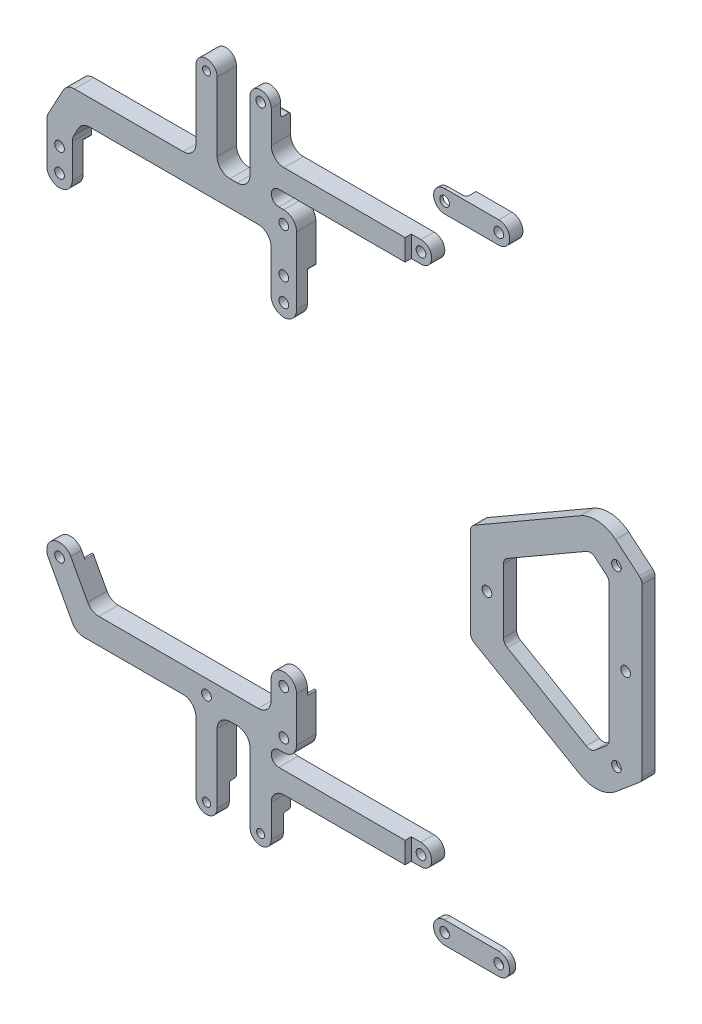
from build123d import *

# Parameters (mm, degrees)
BOSS_EXTRUDE1_OUTLINE_R     = 1.375
BOSS_EXTRUDE1_OUTLINE_R_2   = 1.03775
BOSS_EXTRUDE1_OUTLINE_R_3   = 1.25
BOSS_EXTRUDE1_DEPTH         = 5
BOSS_EXTRUDE1_2_OUTLINE_R   = 1.03775
BOSS_EXTRUDE1_2_OUTLINE_R_2 = 1.25
BOSS_EXTRUDE1_2_OUTLINE_R_3 = 1.375
BOSS_EXTRUDE1_2_DEPTH       = 5
CUT_EXTRUDE4_DEPTH          = 303.619216671
CUT_EXTRUDE4_DEPTH_BACK     = 303.619216671
SKETCH1_3_R                 = 1.22275
SKETCH1_3_R_2               = 1.25
FILLET1_R                   = 3.3
FILLET2_R                   = 3.3
FILLET13_R                  = 1.975016
FILLET14_R                  = 1.975016
SKETCH7_R                   = 1.25
CUT_EXTRUDE8_DEPTH          = 303.619216671
SKETCH2_R                   = 1.03775
CUT_EXTRUDE1_DEPTH          = 2.55
SKETCH3_R                   = 3.3
CUT_EXTRUDE2_DEPTH          = 2.2
FILLET3_START               = -1
FILLET3_DEPTH               = 3.2
FILLET4_START               = -1
FILLET4_DEPTH               = 3.2
MOVE_FACE6_BY               = 0.7
MOVE_FACE6_2_BY             = 0.7
FILLET5_R                   = 0.5
FILLET6_R                   = 0.5
MOVE_FACE3_BY               = 0.125
MOVE_FACE3_2_BY             = 0.125
MOVE_FACE3_3_BY             = 0.125
MOVE_FACE3_4_BY             = 0.125
MOVE_FACE4_BY               = 0.125
MOVE_FACE4_2_BY             = 0.125
SKETCH6_R                   = 2.475
CUT_EXTRUDE5_DEPTH          = 2.2
SKETCH9_R                   = 1.25
BOSS_EXTRUDE2_DEPTH         = 3.4
MOVE_FACE5_DEPTH            = 3.4
FILLET9_R                   = 2
SKETCH10_R                  = 2.475
CUT_EXTRUDE6_DEPTH          = 2.2
FILLET10_R                  = 0.5
FILLET11_R                  = 8
BOSS_EXTRUDE3_START         = -3.15
SKETCH11_R                  = 1.25
BOSS_EXTRUDE3_DEPTH         = 1.55
BOSS_EXTRUDE4_START         = -5
SKETCH12_R                  = 1.25
BOSS_EXTRUDE4_DEPTH         = 3.4
CUT_EXTRUDE7_START          = -3.4
CUT_EXTRUDE7_DEPTH          = 2.55
FILLET12_R                  = 0.75
CUT_EXTRUDE9_START          = -1.6
CUT_EXTRUDE9_DEPTH          = 1.6


with BuildPart() as part:
    # Boss-Extrude1: read off the stored shape, not the designer's step
    # Boss-Extrude1 outline → Boss-Extrude1 (new body)
    with BuildSketch(Plane.XY):
        with BuildLine():
            Line((-122.796119502, -112.908535498), (-122.796119502, -95.408535498))
            ThreePointArc((-122.796119502, -95.408535498), (-123.762667124, -93.075083121), (-126.096119502, -92.108535498))
            Line((-126.096119502, -92.108535498), (-129.338533212, -92.108535498))
            Line((-129.338533212, -92.108535498), (-129.338533212, -88.158504334))
            Line((-129.338533212, -88.158504334), (-92.206195383, -88.158504334))
            ThreePointArc((-92.206195383, -88.158504334), (-89.456195383, -85.408504334), (-92.206195383, -82.658504334))
            Line((-92.206195383, -82.658504334), (-129.338533212, -82.658504334))
            Line((-129.338533212, -82.658504334), (-129.338533212, -71.004269418))
            ThreePointArc((-129.338533212, -71.004269418), (-132.088533212, -68.254269418), (-134.838533212, -71.004269418))
            Line((-134.838533212, -71.004269418), (-134.838533212, -92.108535498))
            Line((-134.838533212, -92.108535498), (-143.338533212, -92.108535498))
            Line((-143.338533212, -92.108535498), (-143.338533212, -71.004269418))
            ThreePointArc((-143.338533212, -71.004269418), (-146.088533212, -68.254269418), (-148.838533212, -71.004269418))
            Line((-148.838533212, -71.004269418), (-148.838533212, -92.108535498))
            Line((-148.838533212, -92.108535498), (-180.236574103, -92.108535498))
            ThreePointArc((-180.236574103, -92.108535498), (-181.923841287, -92.57249434), (-183.136670575, -93.83391159))
            Line((-183.136670575, -93.83391159), (-186.996215974, -100.942309939))
            ThreePointArc((-186.996215974, -100.942309939), (-187.294581504, -101.704627981), (-187.396119502, -102.516933848))
            Line((-187.396119502, -102.516933848), (-187.396119502, -112.908535498))
            ThreePointArc((-187.396119502, -112.908535498), (-184.096119502, -116.208535498), (-180.796119502, -112.908535498))
            Line((-180.796119502, -112.908535498), (-180.796119502, -103.355027081))
            Line((-180.796119502, -103.355027081), (-178.273280414, -98.708535498))
            Line((-178.273280414, -98.708535498), (-129.396119502, -98.708535498))
            Line((-129.396119502, -98.708535498), (-129.396119502, -112.908535498))
            ThreePointArc((-129.396119502, -112.908535498), (-126.096119502, -116.208535498), (-122.796119502, -112.908535498))
        make_face()
        with Locations((-184.096119502, -112.908535498)):
            Circle(BOSS_EXTRUDE1_OUTLINE_R, mode=Mode.SUBTRACT)
        with Locations((-184.096119502, -106.908535498)):
            Circle(BOSS_EXTRUDE1_OUTLINE_R, mode=Mode.SUBTRACT)
        with Locations((-126.096119502, -112.908535498)):
            Circle(BOSS_EXTRUDE1_OUTLINE_R, mode=Mode.SUBTRACT)
        with Locations((-126.096119502, -106.908535498)):
            Circle(BOSS_EXTRUDE1_OUTLINE_R, mode=Mode.SUBTRACT)
        with Locations((-146.088533212, -71.004269418)):
            Circle(BOSS_EXTRUDE1_OUTLINE_R_2, mode=Mode.SUBTRACT)
        with Locations((-92.206195383, -85.408504334)):
            Circle(BOSS_EXTRUDE1_OUTLINE_R_3, mode=Mode.SUBTRACT)
    extrude(amount=BOSS_EXTRUDE1_DEPTH)

    # Sketch1<3> → Cut-Extrude4 (cut, two sides: drawn at the far end of the back side and taken through both)
    with BuildSketch(Plane.XY.offset(-CUT_EXTRUDE4_DEPTH_BACK)):
        with Locations((-132.088533212, -71.004269418)):
            Circle(SKETCH1_3_R)
        with Locations((-92.206195383, -95.408504334)):
            Circle(SKETCH1_3_R_2)
        with Locations((-126.096119502, -95.408504334)):
            Circle(SKETCH1_3_R_2)
    extrude(amount=CUT_EXTRUDE4_DEPTH + CUT_EXTRUDE4_DEPTH_BACK, mode=Mode.SUBTRACT)

    # Fillet1
    fillet1_edges = [part.edges().sort_by_distance(p)[0] for p in [
        (-129.338533212, -82.658504334, 2.5),
        (-148.838533212, -92.108535498, 2.5),
        (-143.338533212, -92.108535498, 2.5),
        (-129.396119502, -98.708535498, 2.5),
        (-178.273280414, -98.708535498, 2.5),
        (-180.796119502, -103.355027081, 2.5),
        (-134.838533212, -92.108535498, 2.5),
    ]]
    fillet(fillet1_edges, radius=FILLET1_R)

    # Fillet13
    fillet13_edges = [part.edges().sort_by_distance(p)[0] for p in [
        (-129.338533212, -88.158504334, 2.5),
        (-129.338533212, -92.108535498, 2.5),
    ]]
    fillet(fillet13_edges, radius=FILLET13_R - 0.0001)  # a hair under: the kernel refuses the full size


with BuildPart() as body_2:
    # Boss-Extrude1 2 outline → Boss-Extrude1 2 (new body)
    with BuildSketch(Plane.XY):
        with BuildLine():
            Line((-129.338533212, -217.658566663), (-129.338533212, -213.708535498))
            Line((-129.338533212, -213.708535498), (-126.096119502, -213.708535498))
            ThreePointArc((-126.096119502, -213.708535498), (-123.762667124, -212.741987876), (-122.796119502, -210.408535498))
            Line((-122.796119502, -210.408535498), (-122.796119502, -198.908535498))
            ThreePointArc((-122.796119502, -198.908535498), (-126.096119502, -195.608535498), (-129.396119502, -198.908535498))
            Line((-129.396119502, -198.908535498), (-129.396119502, -207.108535498))
            Line((-129.396119502, -207.108535498), (-175.888835267, -207.108535498))
            Line((-175.888835267, -207.108535498), (-181.19602303, -197.33391159))
            ThreePointArc((-181.19602303, -197.33391159), (-185.67074341, -196.008439027), (-186.996215974, -200.483159407))
            Line((-186.996215974, -200.483159407), (-180.752225428, -211.983159407))
            ThreePointArc((-180.752225428, -211.983159407), (-179.53939614, -213.244576656), (-177.852128956, -213.708535498))
            Line((-177.852128956, -213.708535498), (-148.838533212, -213.708535498))
            Line((-148.838533212, -213.708535498), (-148.838533212, -234.812801579))
            ThreePointArc((-148.838533212, -234.812801579), (-146.088533212, -237.562801579), (-143.338533212, -234.812801579))
            Line((-143.338533212, -234.812801579), (-143.338533212, -213.708535498))
            Line((-143.338533212, -213.708535498), (-134.838533212, -213.708535498))
            Line((-134.838533212, -213.708535498), (-134.838533212, -234.812801579))
            ThreePointArc((-134.838533212, -234.812801579), (-132.088533212, -237.562801579), (-129.338533212, -234.812801579))
            Line((-129.338533212, -234.812801579), (-129.338533212, -223.158566663))
            Line((-129.338533212, -223.158566663), (-92.206195383, -223.158566663))
            ThreePointArc((-92.206195383, -223.158566663), (-89.456195383, -220.408566663), (-92.206195383, -217.658566663))
            Line((-92.206195383, -217.658566663), (-129.338533212, -217.658566663))
        make_face()
        with Locations((-146.088533212, -234.812801579)):
            Circle(BOSS_EXTRUDE1_2_OUTLINE_R, mode=Mode.SUBTRACT)
        with Locations((-132.088533212, -234.812801579)):
            Circle(BOSS_EXTRUDE1_2_OUTLINE_R, mode=Mode.SUBTRACT)
        with Locations((-92.206195383, -220.408566663)):
            Circle(BOSS_EXTRUDE1_2_OUTLINE_R_2, mode=Mode.SUBTRACT)
        with Locations((-184.096119502, -198.908535498)):
            Circle(BOSS_EXTRUDE1_2_OUTLINE_R_3, mode=Mode.SUBTRACT)
        with Locations((-126.096119502, -210.408535498)):
            Circle(BOSS_EXTRUDE1_2_OUTLINE_R_2, mode=Mode.SUBTRACT)
        with Locations((-126.096119502, -198.908535498)):
            Circle(BOSS_EXTRUDE1_2_OUTLINE_R_3, mode=Mode.SUBTRACT)
    extrude(amount=BOSS_EXTRUDE1_2_DEPTH)

    # Fillet2
    fillet2_edges = [body_2.edges().sort_by_distance(p)[0] for p in [
        (-129.396119502, -207.108535498, 2.5),
        (-175.888835267, -207.108535498, 2.5),
        (-148.838533212, -213.708535498, 2.5),
        (-143.338533212, -213.708535498, 2.5),
        (-134.838533212, -213.708535498, 2.5),
        (-129.338533212, -223.158566663, 2.5),
    ]]
    fillet(fillet2_edges, radius=FILLET2_R)

    # Fillet14
    fillet14_edges = [body_2.edges().sort_by_distance(p)[0] for p in [
        (-129.338533212, -217.658566663, 2.5),
        (-129.338533212, -213.708535498, 2.5),
    ]]
    fillet(fillet14_edges, radius=FILLET14_R - 0.0001)  # a hair under: the kernel refuses the full size

    # Sketch7 → Cut-Extrude8 (cut, through all)
    with BuildSketch(Plane.XY.offset(5)):
        with Locations((-146.088533212, -210.812801579)):
            Circle(SKETCH7_R)
    extrude(amount=-CUT_EXTRUDE8_DEPTH, mode=Mode.SUBTRACT)


with BuildPart() as cut_extrude1_tool:
    # Sketch2 → Cut-Extrude1 (new body)
    # profile 1 of 3: a face of its own
    with BuildSketch(Plane(origin=(0, 0, 0), x_dir=(-1, 0, 0), z_dir=(0, 0, -1))):
        with BuildLine():
            Line((134.838533212, -74.304269418), (134.838533212, -71.004269418))
            ThreePointArc((134.838533212, -71.004269418), (132.088533212, -68.254269418), (129.338533212, -71.004269418))
            Line((129.338533212, -71.004269418), (129.338533212, -74.304269418))
            Line((129.338533212, -74.304269418), (134.838533212, -74.304269418))
        make_face()
        with Locations((132.088533212, -71.004269418)):
            Circle(SKETCH2_R, mode=Mode.SUBTRACT)
    # profile 2 of 3: a face of its own
    with BuildSketch(Plane(origin=(0, 0, 0), x_dir=(-1, 0, 0), z_dir=(0, 0, -1))):
        with BuildLine():
            Line((143.338533212, -230.312801579), (143.338533212, -234.812801579))
            ThreePointArc((143.338533212, -234.812801579), (146.088533212, -237.562801579), (148.838533212, -234.812801579))
            Line((148.838533212, -234.812801579), (148.838533212, -230.312801579))
            Line((148.838533212, -230.312801579), (143.338533212, -230.312801579))
        make_face()
        with Locations((146.088533212, -234.812801579)):
            Circle(SKETCH2_R, mode=Mode.SUBTRACT)
    # profile 3 of 3: a face of its own
    with BuildSketch(Plane(origin=(0, 0, 0), x_dir=(-1, 0, 0), z_dir=(0, 0, -1))):
        with BuildLine():
            Line((129.338533212, -230.312801579), (129.338533212, -234.812801579))
            ThreePointArc((129.338533212, -234.812801579), (132.088533212, -237.562801579), (134.838533212, -234.812801579))
            Line((134.838533212, -234.812801579), (134.838533212, -230.312801579))
            Line((134.838533212, -230.312801579), (129.338533212, -230.312801579))
        make_face()
        with Locations((132.088533212, -234.812801579)):
            Circle(SKETCH2_R, mode=Mode.SUBTRACT)
    extrude(amount=-CUT_EXTRUDE1_DEPTH)


with BuildPart() as part_1:
    add(part.part)

    # Cut-Extrude1: cut by cut_extrude1_tool
    add(cut_extrude1_tool.part, mode=Mode.SUBTRACT)


with BuildPart() as body_2_1:
    add(body_2.part)

    # Cut-Extrude1: cut by cut_extrude1_tool
    add(cut_extrude1_tool.part, mode=Mode.SUBTRACT)


with BuildPart() as cut_extrude2_tool:
    # Sketch3 → Cut-Extrude2 (new body)
    with BuildSketch(Plane(origin=(0, 0, 0), x_dir=(-1, 0, 0), z_dir=(0, 0, -1))):
        with Locations((126.096119502, -198.908535498)):
            Circle(SKETCH3_R)
        with Locations((184.096119502, -198.908535498)):
            Circle(SKETCH3_R)
        with BuildLine():
            Line((122.796119502, -112.908535498), (122.796119502, -106.908535498))
            ThreePointArc((122.796119502, -106.908535498), (126.096119502, -103.608535498), (129.396119502, -106.908535498))
            Line((129.396119502, -106.908535498), (129.396119502, -112.908535498))
            ThreePointArc((129.396119502, -112.908535498), (126.096119502, -116.208535498), (122.796119502, -112.908535498))
        make_face()
        with BuildLine():
            Line((180.796119502, -112.908535498), (180.796119502, -106.908535498))
            ThreePointArc((180.796119502, -106.908535498), (184.096119502, -103.608535498), (187.396119502, -106.908535498))
            Line((187.396119502, -106.908535498), (187.396119502, -112.908535498))
            ThreePointArc((187.396119502, -112.908535498), (184.096119502, -116.208535498), (180.796119502, -112.908535498))
        make_face()
    extrude(amount=-CUT_EXTRUDE2_DEPTH)


with BuildPart() as part_2:
    add(part_1.part)

    # Cut-Extrude2: cut by cut_extrude2_tool
    add(cut_extrude2_tool.part, mode=Mode.SUBTRACT)

    # Fillet3: read off the stored shape, not the designer's step
    # Fillet3 outline → Fillet3 (cut)
    with BuildSketch(Plane.XY.offset(FILLET3_START)):
        with BuildLine():
            Line((-180.796119502, -106.908535498), (-180.796119502, -105.091945286))
            ThreePointArc((-180.796119502, -105.091945286), (-180.979776391, -105.33298178), (-181.260908235, -105.219874174))
            ThreePointArc((-181.260908235, -105.219874174), (-180.914437778, -106.032806425), (-180.796119502, -106.908535498))
        make_face()
        with BuildLine():
            ThreePointArc((-187.396119502, -106.908535498), (-187.277801226, -106.032806426), (-186.93133077, -105.219874174))
            ThreePointArc((-186.93133077, -105.219874174), (-187.212462614, -105.33298178), (-187.396119502, -105.091945286))
            Line((-187.396119502, -105.091945286), (-187.396119502, -106.908535498))
        make_face()
        with BuildLine():
            Line((-122.796119502, -106.908535498), (-122.796119502, -105.091945286))
            ThreePointArc((-122.796119502, -105.091945286), (-122.979776391, -105.33298178), (-123.260908235, -105.219874174))
            ThreePointArc((-123.260908235, -105.219874174), (-122.914437778, -106.032806425), (-122.796119502, -106.908535498))
        make_face()
        with BuildLine():
            ThreePointArc((-129.396119502, -106.908535498), (-129.277801226, -106.032806426), (-128.93133077, -105.219874174))
            ThreePointArc((-128.93133077, -105.219874174), (-129.212462614, -105.33298178), (-129.396119502, -105.091945286))
            Line((-129.396119502, -105.091945286), (-129.396119502, -106.908535498))
        make_face()
    extrude(amount=FILLET3_DEPTH, mode=Mode.SUBTRACT)

    # Fillet6
    fillet6_edges = [part_2.edges().sort_by_distance(p)[0] for p in [
        (-132.088533212, -74.304269418, 2.55),
        (-132.088533212, -74.304269418, 0),
    ]]
    fillet(fillet6_edges, radius=FILLET6_R)

    # Move Face3: a curved face moved outward by 0.125
    add(Solid.thicken(part_2.faces().sort_by_distance((-127.471119502, -112.908535498, 3.6))[0], MOVE_FACE3_BY))

    # Move Face3 2: a curved face moved outward by 0.125
    add(Solid.thicken(part_2.faces().sort_by_distance((-185.471119502, -112.908535498, 3.6))[0], MOVE_FACE3_2_BY))

    # Move Face3 3: a curved face moved outward by 0.125
    add(Solid.thicken(part_2.faces().sort_by_distance((-185.471119502, -106.908535498, 3.6))[0], MOVE_FACE3_3_BY))

    # Move Face3 4: a curved face moved outward by 0.125
    add(Solid.thicken(part_2.faces().sort_by_distance((-127.471119502, -106.908535498, 3.6))[0], MOVE_FACE3_4_BY))


with BuildPart() as body_2_2:
    add(body_2_1.part)

    # Cut-Extrude2: cut by cut_extrude2_tool
    add(cut_extrude2_tool.part, mode=Mode.SUBTRACT)

    # Fillet4: read off the stored shape, not the designer's step
    # Fillet4 outline → Fillet4 (cut)
    with BuildSketch(Plane.XY.offset(FILLET4_START)):
        with BuildLine():
            ThreePointArc((-181.19602303, -197.33391159), (-180.882141358, -198.159973887), (-180.798727778, -199.039714074))
            ThreePointArc((-180.798727778, -199.039714074), (-180.605634588, -198.806168652), (-180.329221097, -198.930362155))
            Line((-180.329221097, -198.930362155), (-181.19602303, -197.33391159))
        make_face()
        with BuildLine():
            ThreePointArc((-186.12941404, -202.079609973), (-186.083025899, -201.780149484), (-185.781992138, -201.745405861))
            ThreePointArc((-185.781992138, -201.745405861), (-186.47437405, -201.1963085), (-186.996215974, -200.483159407))
            Line((-186.996215974, -200.483159407), (-186.12941404, -202.079609973))
        make_face()
        with BuildLine():
            Line((-129.396119502, -198.908535498), (-129.396119502, -200.725125711))
            ThreePointArc((-129.396119502, -200.725125711), (-129.212462614, -200.484089217), (-128.93133077, -200.597196823))
            ThreePointArc((-128.93133077, -200.597196823), (-129.277801226, -199.784264571), (-129.396119502, -198.908535498))
        make_face()
        with BuildLine():
            ThreePointArc((-122.796119502, -198.908535498), (-122.914437778, -199.784264571), (-123.260908235, -200.597196823))
            ThreePointArc((-123.260908235, -200.597196823), (-122.979776391, -200.484089217), (-122.796119502, -200.725125711))
            Line((-122.796119502, -200.725125711), (-122.796119502, -198.908535498))
        make_face()
    extrude(amount=FILLET4_DEPTH, mode=Mode.SUBTRACT)

    # Move Face6: a face moved outward by 0.7
    extrude(body_2_2.faces().sort_by_distance((-132.088533212, -233.5548139, 2.55))[0], amount=MOVE_FACE6_BY, dir=(0, 0, -1))

    # Move Face6 2: a face moved outward by 0.7
    extrude(body_2_2.faces().sort_by_distance((-146.088533212, -233.5548139, 2.55))[0], amount=MOVE_FACE6_2_BY, dir=(0, 0, -1))

    # Fillet5
    fillet5_edges = [body_2_2.edges().sort_by_distance(p)[0] for p in [
        (-146.088533212, -230.312801579, 1.85),
        (-146.088533212, -230.312801579, 0),
        (-132.088533212, -230.312801579, 1.85),
        (-132.088533212, -230.312801579, 0),
    ]]
    fillet(fillet5_edges, radius=FILLET5_R)

    # Move Face4: a curved face moved outward by 0.125
    add(Solid.thicken(body_2_2.faces().sort_by_distance((-185.471119502, -198.908535498, 3.6))[0], MOVE_FACE4_BY))

    # Move Face4 2: a curved face moved outward by 0.125
    add(Solid.thicken(body_2_2.faces().sort_by_distance((-127.471119502, -198.908535498, 3.6))[0], MOVE_FACE4_2_BY))


with BuildPart() as cut_extrude5_tool:
    # Sketch6 → Cut-Extrude5 (new body)
    with BuildSketch(Plane(origin=(0, 0, 0), x_dir=(-1, 0, 0), z_dir=(0, 0, -1))):
        with Locations((126.096119502, -210.408535498)):
            Circle(SKETCH6_R)
        with Locations((126.096119502, -95.408504334)):
            Circle(SKETCH6_R)
        with Locations((146.088533212, -210.812801579)):
            Circle(SKETCH6_R)
    extrude(amount=-CUT_EXTRUDE5_DEPTH)


with BuildPart() as part_3:
    add(part_2.part)

    # Cut-Extrude5: cut by cut_extrude5_tool
    add(cut_extrude5_tool.part, mode=Mode.SUBTRACT)


with BuildPart() as body_2_3:
    add(body_2_2.part)

    # Cut-Extrude5: cut by cut_extrude5_tool
    add(cut_extrude5_tool.part, mode=Mode.SUBTRACT)


with BuildPart() as body_3:
    # Sketch9 → Boss-Extrude2 (new body)
    with BuildSketch(Plane.XY):
        Polygon((-79.402742617, -138.56254712), (-79.402742617, -152.908535498), (-79.402742617, -167.253532055), (-47.355782649, -185.75566152), (-38.912698215, -178.672075775), (-35.031744693, -175.416030278), (-35.031744693, -130.401040719), (-47.356482927, -120.060821957), align=None)
        with Locations((-75.142742617, -152.908535498)):
            Circle(SKETCH9_R, mode=Mode.SUBTRACT)
        with Locations((-39.291744693, -152.908535498)):
            Circle(SKETCH9_R, mode=Mode.SUBTRACT)
        with Locations((-41.650745852, -175.408535498)):
            Circle(SKETCH9_R, mode=Mode.SUBTRACT)
        with Locations((-41.650745852, -130.408535498)):
            Circle(SKETCH9_R, mode=Mode.SUBTRACT)
        Polygon((-70.882742617, -143.48159687), (-70.882742617, -152.908535498), (-70.882742617, -162.334482306), (-48.261927876, -175.394480613), (-44.388793489, -172.144995222), (-43.551744693, -171.442727351), (-43.551744693, -134.374343645), (-48.262628154, -130.422002864), align=None, mode=Mode.SUBTRACT)
    extrude(amount=BOSS_EXTRUDE2_DEPTH)

    # Move Face5: read off the stored shape, not the designer's step
    # Move Face5 outline → Move Face5 (cut)
    with BuildSketch(Plane.XY):
        Polygon((-79.402742617, -138.56254712), (-79.402742617, -140.294593446), (-46.133567135, -121.086824829), (-47.356482927, -120.060821957), align=None)
        Polygon((-46.132866857, -184.729658649), (-79.402742617, -165.521485729), (-79.402742617, -167.253532055), (-47.355782649, -185.75566152), align=None)
    extrude(amount=MOVE_FACE5_DEPTH, mode=Mode.SUBTRACT)

    # Fillet9
    fillet9_edges = [body_3.edges().sort_by_distance(p)[0] for p in [
        (-35.031744693, -130.401040719, 1.7),
        (-35.031744693, -175.416030278, 1.7),
        (-79.402742617, -165.521485729, 1.7),
        (-79.402742617, -140.294593446, 1.7),
        (-70.882742617, -143.48159687, 1.7),
        (-70.882742617, -162.334482306, 1.7),
        (-48.261927876, -175.394480613, 1.7),
        (-43.551744693, -171.442727351, 1.7),
        (-43.551744693, -134.374343645, 1.7),
        (-48.262628154, -130.422002864, 1.7),
    ]]
    fillet(fillet9_edges, radius=FILLET9_R)

    # Sketch10 → Cut-Extrude6 (cut)
    with BuildSketch(Plane(origin=(0, 0, 0), x_dir=(-1, 0, 0), z_dir=(0, 0, -1))):
        with Locations((41.650745852, -175.408535498)):
            Circle(SKETCH10_R)
        with Locations((41.650745852, -130.408535498)):
            Circle(SKETCH10_R)
    extrude(amount=-CUT_EXTRUDE6_DEPTH, mode=Mode.SUBTRACT)

    # Fillet10
    fillet10_edges = [body_3.edges().sort_by_distance(p)[0] for p in [
        (-39.175745852, -175.408535498, 0),
        (-39.175745852, -130.408535498, 0),
    ]]
    fillet(fillet10_edges, radius=FILLET10_R)

    # Fillet11
    fillet11_edges = [body_3.edges().sort_by_distance(p)[0] for p in [
        (-46.132866857, -184.729658649, 1.7),
        (-46.133567135, -121.086824829, 1.7),
    ]]
    fillet(fillet11_edges, radius=FILLET11_R)


with BuildPart() as body_4:
    # Sketch11 → Boss-Extrude3 (new body)
    with BuildSketch(Plane.XY.offset(5).offset(BOSS_EXTRUDE3_START)):
        with BuildLine():
            Line((-72.103705793, -237.662801579), (-86.103705793, -237.662801579))
            ThreePointArc((-86.103705793, -237.662801579), (-88.953705793, -234.812801579), (-86.103705793, -231.962801579))
            Line((-86.103705793, -231.962801579), (-72.103705793, -231.962801579))
            ThreePointArc((-72.103705793, -231.962801579), (-69.253705793, -234.812801579), (-72.103705793, -237.662801579))
        make_face()
        with Locations((-72.103705793, -234.812801579)):
            Circle(SKETCH11_R, mode=Mode.SUBTRACT)
        with Locations((-86.103705793, -234.812801579)):
            Circle(SKETCH11_R, mode=Mode.SUBTRACT)
    extrude(amount=BOSS_EXTRUDE3_DEPTH)


with BuildPart() as body_5:
    # Sketch12 → Boss-Extrude4 (new body)
    with BuildSketch(Plane.XY.offset(5).offset(BOSS_EXTRUDE4_START)):
        with BuildLine():
            Line((-72.103705793, -73.854269418), (-86.103705793, -73.854269418))
            ThreePointArc((-86.103705793, -73.854269418), (-88.953705793, -71.004269418), (-86.103705793, -68.154269418))
            Line((-86.103705793, -68.154269418), (-72.103705793, -68.154269418))
            ThreePointArc((-72.103705793, -68.154269418), (-69.253705793, -71.004269418), (-72.103705793, -73.854269418))
        make_face()
        with Locations((-86.103705793, -71.004269418)):
            Circle(SKETCH12_R, mode=Mode.SUBTRACT)
        with Locations((-72.103705793, -71.004269418)):
            Circle(SKETCH12_R, mode=Mode.SUBTRACT)
    extrude(amount=BOSS_EXTRUDE4_DEPTH)

    # Sketch13 → Cut-Extrude7 (cut)
    with BuildSketch(Plane.XY.offset(3.4).offset(CUT_EXTRUDE7_START)):
        with BuildLine():
            Line((-81.353705793, -68.154269418), (-81.353705793, -73.854269418))
            Line((-81.353705793, -73.854269418), (-86.103705793, -73.854269418))
            ThreePointArc((-86.103705793, -73.854269418), (-88.953705793, -71.004269418), (-86.103705793, -68.154269418))
            Line((-86.103705793, -68.154269418), (-81.353705793, -68.154269418))
        make_face()
    extrude(amount=CUT_EXTRUDE7_DEPTH, mode=Mode.SUBTRACT)

    # Fillet12
    fillet12_edges = [body_5.edges().sort_by_distance(p)[0] for p in [
        (-81.353705793, -71.004269418, 2.55),
    ]]
    fillet(fillet12_edges, radius=FILLET12_R)


with BuildPart() as cut_extrude9_tool:
    # Sketch15 → Cut-Extrude9 (new body)
    with BuildSketch(Plane.XY.offset(5).offset(CUT_EXTRUDE9_START)):
        with BuildLine():
            Line((-92.206195383, -223.158566663), (-94.706195383, -223.158566663))
            Line((-94.706195383, -223.158566663), (-94.706195383, -217.658566663))
            Line((-94.706195383, -217.658566663), (-92.206195383, -217.658566663))
            ThreePointArc((-92.206195383, -217.658566663), (-89.456195383, -220.408566663), (-92.206195383, -223.158566663))
        make_face()
        with BuildLine():
            Line((-92.206195383, -88.158504334), (-94.706195383, -88.158504334))
            Line((-94.706195383, -88.158504334), (-94.706195383, -82.658504334))
            Line((-94.706195383, -82.658504334), (-92.206195383, -82.658504334))
            ThreePointArc((-92.206195383, -82.658504334), (-89.456195383, -85.408504334), (-92.206195383, -88.158504334))
        make_face()
    extrude(amount=CUT_EXTRUDE9_DEPTH)


with BuildPart() as part_4:
    add(part_3.part)

    # Cut-Extrude9: cut by cut_extrude9_tool
    add(cut_extrude9_tool.part, mode=Mode.SUBTRACT)


with BuildPart() as body_2_4:
    add(body_2_3.part)

    # Cut-Extrude9: cut by cut_extrude9_tool
    add(cut_extrude9_tool.part, mode=Mode.SUBTRACT)


solid = Compound([body_3.part, body_4.part, body_5.part, part_4.part, body_2_4.part])
